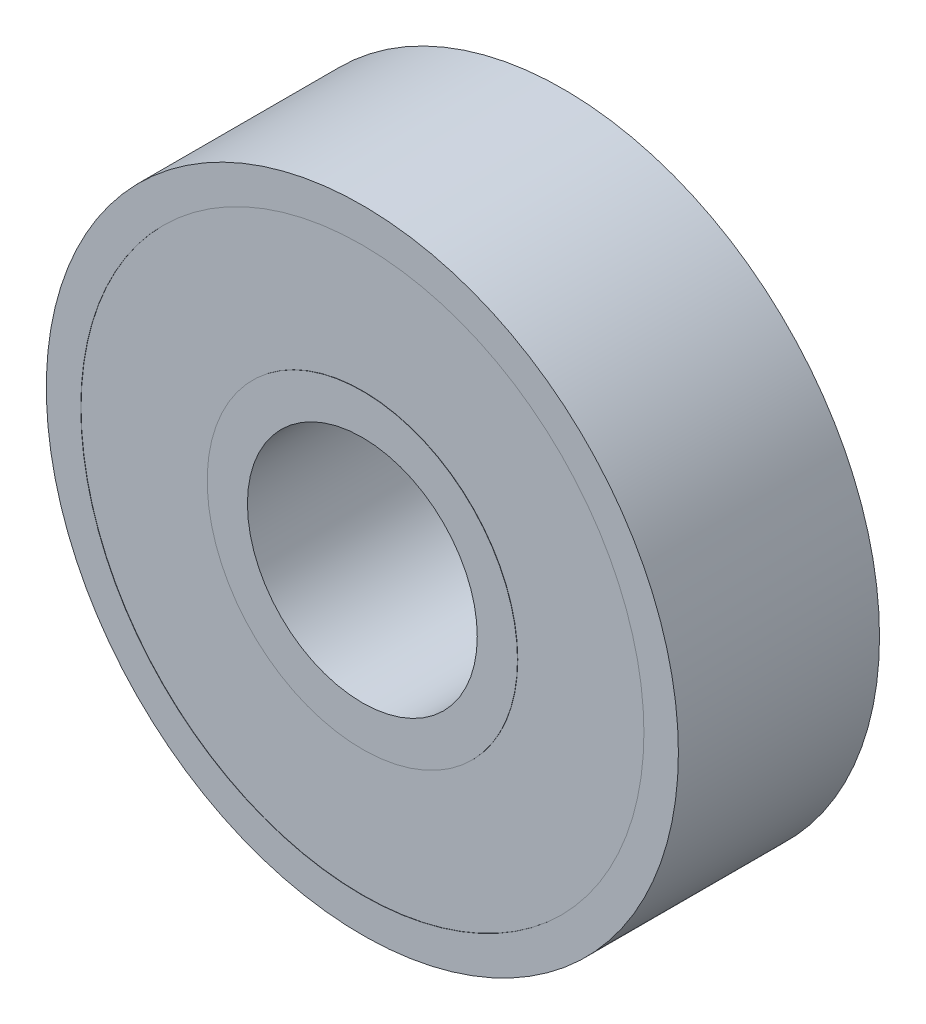
from build123d import *

# Parameters (mm, degrees)
SKETCH1_R             = 5.4
SKETCH1_R_2           = 4
BOSS_EXTRUDE1_DEPTH   = 7
SKETCH1_R_3           = 11
SKETCH1_R_4           = 9.8
BOSS_EXTRUDE1_2_DEPTH = 7
BOSS_EXTRUDE2_START   = 0.01
SKETCH1_3_R           = 9.8
SKETCH1_3_R_2         = 5.4
BOSS_EXTRUDE2_DEPTH   = 6.98


with BuildPart() as part:
    # Sketch1 → Boss-Extrude1 (new body)
    with BuildSketch(Plane.XY):
        Circle(SKETCH1_R)
        Circle(SKETCH1_R_2, mode=Mode.SUBTRACT)
    extrude(amount=BOSS_EXTRUDE1_DEPTH)



with BuildPart() as body_2:
    # Sketch1 → Boss-Extrude1 2 (new body)
    with BuildSketch(Plane.XY):
        Circle(SKETCH1_R_3)
        Circle(SKETCH1_R_4, mode=Mode.SUBTRACT)
    extrude(amount=BOSS_EXTRUDE1_2_DEPTH)


with BuildPart() as part_1:
    add(part.part)

    add(body_2.part)  # Boss-Extrude2 merges body 2
    # Sketch1<3> → Boss-Extrude2 (add)
    with BuildSketch(Plane.XY.offset(BOSS_EXTRUDE2_START)):
        Circle(SKETCH1_3_R)
        Circle(SKETCH1_3_R_2, mode=Mode.SUBTRACT)
    extrude(amount=BOSS_EXTRUDE2_DEPTH)


solid = part_1.part
